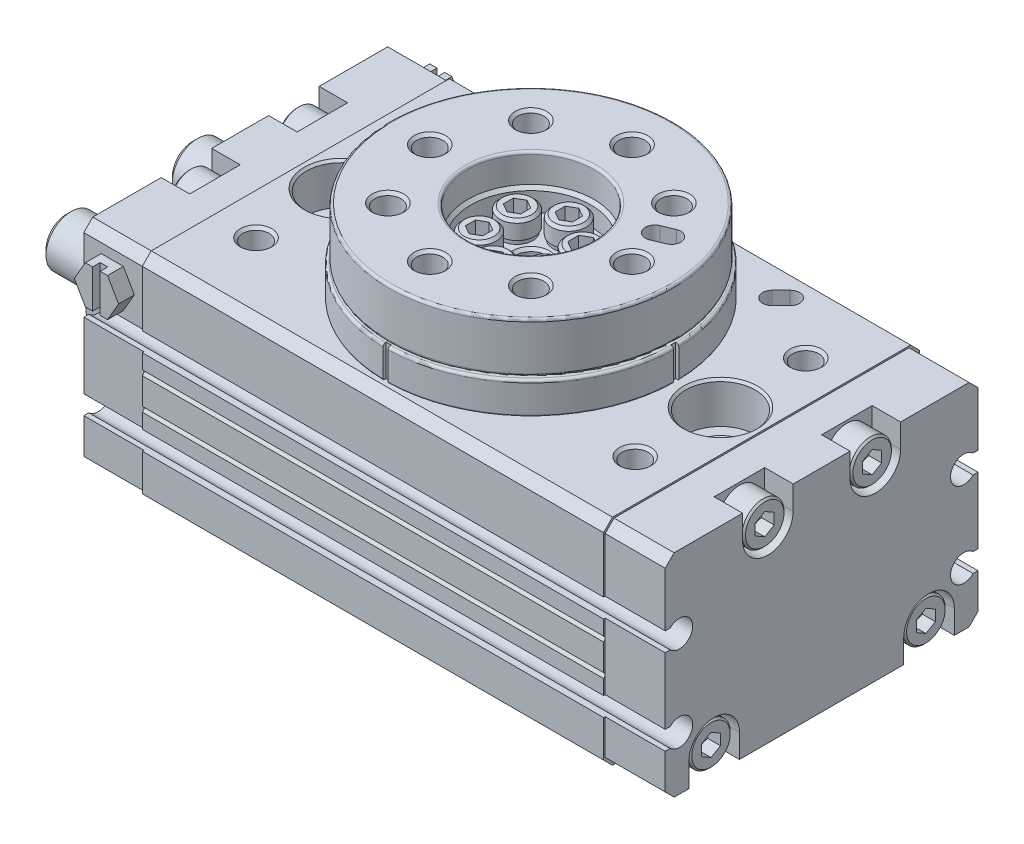
from build123d import *

# Parameters (mm, degrees)
EXTRUDE_1_DEPTH      = 36.5
EXTRUDE_1_DEPTH_BACK = 36.5
EXTRUDE_2_DEPTH      = 9.5
EXTRUDE_START        = -9.5
EXTRUDE_3_DEPTH      = 9.5
SKETCH_7_R           = 8
CUT_EXTRUDE_1_DEPTH  = 9.5
SKETCH_8_R           = 8
CUT_EXTRUDE_2_DEPTH  = 9.5
CUT_EXTRUDE_3_DEPTH  = 3.5
CUT_EXTRUDE_4_DEPTH  = 3.5
CUT_EXTRUDE_5_DEPTH  = 3.5
CUT_EXTRUDE_6_DEPTH  = 7.5
CUT_EXTRUDE_7_DEPTH  = 7.5
CUT_EXTRUDE_8_DEPTH  = 7.5
CUT_EXTRUDE_9_DEPTH  = 7.5
CUT_EXTRUDE_10_DEPTH = 7.5
CUT_EXTRUDE_11_DEPTH = 7.5
EXTRUDE_4_DEPTH      = 10
EXTRUDE_5_DEPTH      = 10
SKETCH_45_W          = 1.2
SKETCH_45_H          = 1.2
CUT_EXTRUDE_12_DEPTH = 10
SKETCH_46_W          = 1.2
SKETCH_46_H          = 1.2
CUT_EXTRUDE_13_DEPTH = 10
CUT_EXTRUDE_14_DEPTH = 4.5
CUT_EXTRUDE_15_DEPTH = 4.5
CUT_EXTRUDE_16_DEPTH = 4.5
CUT_EXTRUDE_17_DEPTH = 4.5
CUT_EXTRUDE_START    = 4.5
CUT_EXTRUDE_18_DEPTH = 4.5
CUT_EXTRUDE_19_DEPTH = 4.5
CUT_EXTRUDE_20_DEPTH = 4.5
CUT_EXTRUDE_21_DEPTH = 4.5
SKETCH_63_R          = 2.732050808
EXTRUDE_6_DEPTH      = 4.5
SKETCH_64_R          = 2.732050808
EXTRUDE_7_DEPTH      = 4.5
SKETCH_65_R          = 2.732050808
EXTRUDE_8_DEPTH      = 4.5
SKETCH_66_R          = 2.732050808
EXTRUDE_9_DEPTH      = 4.5
SKETCH_67_R          = 2.732050808
EXTRUDE_10_DEPTH     = 4.5
SKETCH_68_R          = 2.732050808
EXTRUDE_11_DEPTH     = 4.5
SKETCH_69_R          = 2.732050808
EXTRUDE_12_DEPTH     = 4.5
SKETCH_70_R          = 2.732050808
EXTRUDE_13_DEPTH     = 4.5
CUT_EXTRUDE_START_2  = -5
SKETCH_71_R          = 26
CUT_EXTRUDE_22_DEPTH = 5


with BuildPart() as part:
    # 草图1 → 凸台-拉伸1 (new, two sides: drawn at the far end of the back side and taken through both)
    with BuildSketch(Plane(origin=(0, 0, 0), x_dir=(0, 0, -1), z_dir=(1, 0, 0)).offset(-EXTRUDE_1_DEPTH_BACK)):
        with BuildLine():
            Line((-25, 23.75), (-23.969693846, 23.75))
            ThreePointArc((-23.969693846, 23.75), (-20.4, 22.25), (-23.969693846, 20.75))
            Line((-23.969693846, 20.75), (-25, 20.75))
            Line((-25, 20.75), (-25, 18.4))
            Line((-25, 18.4), (-24.6, 18))
            Line((-24.6, 18), (-25, 17.6))
            Line((-25, 17.6), (-25, 13.4))
            Line((-25, 13.4), (-24.6, 13))
            Line((-24.6, 13), (-25, 12.6))
            Line((-25, 12.6), (-25, 10.25))
            Line((-25, 10.25), (-23.969693846, 10.25))
            ThreePointArc((-23.969693846, 10.25), (-20.4, 8.75), (-23.969693846, 7.25))
            Line((-23.969693846, 7.25), (-25, 7.25))
            Line((-25, 7.25), (-25, 1.414213562))
            Line((-25, 1.414213562), (-23.585786438, 0))
            Line((-23.585786438, 0), (23.585786438, 0))
            Line((23.585786438, 0), (25, 1.414213562))
            Line((25, 1.414213562), (25, 7.25))
            Line((25, 7.25), (23.969693846, 7.25))
            ThreePointArc((23.969693846, 7.25), (20.4, 8.75), (23.969693846, 10.25))
            Line((23.969693846, 10.25), (25, 10.25))
            Line((25, 10.25), (25, 12.6))
            Line((25, 12.6), (24.6, 13))
            Line((24.6, 13), (25, 13.4))
            Line((25, 13.4), (25, 17.6))
            Line((25, 17.6), (24.6, 18))
            Line((24.6, 18), (25, 18.4))
            Line((25, 18.4), (25, 20.75))
            Line((25, 20.75), (23.969693846, 20.75))
            ThreePointArc((23.969693846, 20.75), (20.4, 22.25), (23.969693846, 23.75))
            Line((23.969693846, 23.75), (25, 23.75))
            Line((25, 23.75), (25, 32.585786438))
            Line((25, 32.585786438), (23.585786438, 34))
            Line((23.585786438, 34), (-23.585786438, 34))
            Line((-23.585786438, 34), (-25, 32.585786438))
            Line((-25, 32.585786438), (-25, 23.75))
        make_face()
    extrude(amount=EXTRUDE_1_DEPTH + EXTRUDE_1_DEPTH_BACK)

    # 草图2 → 旋转1 (revolve)
    with BuildSketch(Plane.XY):
        with BuildLine():
            Line((0, 39), (9.5, 39))
            Line((9.5, 39), (9.5, 42))
            Line((9.5, 42), (10, 42.5))
            Line((10, 42.5), (10, 46.6))
            ThreePointArc((10, 46.6), (10.117157288, 46.882842712), (10.4, 47))
            Line((10.4, 47), (22.1, 47))
            ThreePointArc((22.1, 47), (22.382842712, 46.882842712), (22.5, 46.6))
            Line((22.5, 46.6), (22.5, 39.5))
            ThreePointArc((22.5, 39.5), (22.353553391, 39.146446609), (22, 39))
            Line((22, 39), (22.6, 39))
            ThreePointArc((22.6, 39), (22.882842712, 38.882842712), (23, 38.6))
            Line((23, 38.6), (23, 34.2))
            ThreePointArc((23, 34.2), (22.941421356, 34.058578644), (22.8, 34))
            Line((22.8, 34), (0, 34))
            Line((0, 34), (0, 39))
        make_face()
    revolve(axis=Axis((0, 34, 0), (0, 1, 0)))

    # 草图3 → 凸台-拉伸2 (add)
    with BuildSketch(Plane(origin=(36.5, 0, 0), x_dir=(0, 0, -1), z_dir=(1, 0, 0))):
        with BuildLine():
            Line((-24.75, 23.75), (-23.969693846, 23.75))
            ThreePointArc((-23.969693846, 23.75), (-20.4, 22.25), (-23.969693846, 20.75))
            Line((-23.969693846, 20.75), (-24.75, 20.75))
            Line((-24.75, 20.75), (-24.75, 10.25))
            Line((-24.75, 10.25), (-23.969693846, 10.25))
            ThreePointArc((-23.969693846, 10.25), (-20.4, 8.75), (-23.969693846, 7.25))
            Line((-23.969693846, 7.25), (-24.75, 7.25))
            Line((-24.75, 7.25), (-24.75, 1.664213562))
            Line((-24.75, 1.664213562), (-23.335786438, 0.25))
            Line((-23.335786438, 0.25), (23.335786438, 0.25))
            Line((23.335786438, 0.25), (24.75, 1.664213562))
            Line((24.75, 1.664213562), (24.75, 7.25))
            Line((24.75, 7.25), (23.969693846, 7.25))
            ThreePointArc((23.969693846, 7.25), (20.4, 8.75), (23.969693846, 10.25))
            Line((23.969693846, 10.25), (24.75, 10.25))
            Line((24.75, 10.25), (24.75, 20.75))
            Line((24.75, 20.75), (23.969693846, 20.75))
            ThreePointArc((23.969693846, 20.75), (20.4, 22.25), (23.969693846, 23.75))
            Line((23.969693846, 23.75), (24.75, 23.75))
            Line((24.75, 23.75), (24.75, 32.335786438))
            Line((24.75, 32.335786438), (23.335786438, 33.75))
            Line((23.335786438, 33.75), (-23.335786438, 33.75))
            Line((-23.335786438, 33.75), (-24.75, 32.335786438))
            Line((-24.75, 32.335786438), (-24.75, 23.75))
        make_face()
    extrude(amount=EXTRUDE_2_DEPTH)

    # 草图4 → 凸台-拉伸3 (add)
    with BuildSketch(Plane(origin=(-36.5, 0, 0), x_dir=(0, 0, -1), z_dir=(1, 0, 0)).offset(EXTRUDE_START)):
        with BuildLine():
            Line((-24.75, 23.75), (-23.969693846, 23.75))
            ThreePointArc((-23.969693846, 23.75), (-20.4, 22.25), (-23.969693846, 20.75))
            Line((-23.969693846, 20.75), (-24.75, 20.75))
            Line((-24.75, 20.75), (-24.75, 10.25))
            Line((-24.75, 10.25), (-23.969693846, 10.25))
            ThreePointArc((-23.969693846, 10.25), (-20.4, 8.75), (-23.969693846, 7.25))
            Line((-23.969693846, 7.25), (-24.75, 7.25))
            Line((-24.75, 7.25), (-24.75, 1.664213562))
            Line((-24.75, 1.664213562), (-23.335786438, 0.25))
            Line((-23.335786438, 0.25), (23.335786438, 0.25))
            Line((23.335786438, 0.25), (24.75, 1.664213562))
            Line((24.75, 1.664213562), (24.75, 7.25))
            Line((24.75, 7.25), (23.969693846, 7.25))
            ThreePointArc((23.969693846, 7.25), (20.4, 8.75), (23.969693846, 10.25))
            Line((23.969693846, 10.25), (24.75, 10.25))
            Line((24.75, 10.25), (24.75, 20.75))
            Line((24.75, 20.75), (23.969693846, 20.75))
            ThreePointArc((23.969693846, 20.75), (20.4, 22.25), (23.969693846, 23.75))
            Line((23.969693846, 23.75), (24.75, 23.75))
            Line((24.75, 23.75), (24.75, 32.335786438))
            Line((24.75, 32.335786438), (23.335786438, 33.75))
            Line((23.335786438, 33.75), (-23.335786438, 33.75))
            Line((-23.335786438, 33.75), (-24.75, 32.335786438))
            Line((-24.75, 32.335786438), (-24.75, 23.75))
        make_face()
    extrude(amount=EXTRUDE_3_DEPTH)

    # 草图5 → 旋转2 (revolve)
    with BuildSketch(Plane(origin=(0, 15.5, 0), x_dir=(1, 0, 0), z_dir=(0, 1, 0))):
        with BuildLine():
            Line((-63.5, 10), (-63.5, 13.233))
            Line((-63.5, 13.233), (-62.733, 14))
            Line((-62.733, 14), (-54.5, 14))
            Line((-54.5, 14), (-54.5, 15.95))
            ThreePointArc((-54.5, 15.95), (-53.972792206, 17.222792206), (-52.7, 17.75))
            Line((-52.7, 17.75), (-47.75, 17.75))
            Line((-47.75, 17.75), (-47.5, 17.5))
            Line((-47.5, 17.5), (-47.25, 17.75))
            Line((-47.25, 17.75), (-46, 17.75))
            Line((-46, 17.75), (-46, 10))
            Line((-46, 10), (-63.5, 10))
        make_face()
    revolve(axis=Axis((-46, 15.5, -10), (-1, 0, 0)))

    # 草图6 → 旋转3 (revolve)
    with BuildSketch(Plane(origin=(0, 15.5, 0), x_dir=(1, 0, 0), z_dir=(0, 1, 0))):
        with BuildLine():
            Line((-63.5, -10), (-63.5, -6.767))
            Line((-63.5, -6.767), (-62.733, -6))
            Line((-62.733, -6), (-54.5, -6))
            Line((-54.5, -6), (-54.5, -4.05))
            ThreePointArc((-54.5, -4.05), (-53.972792206, -2.777207794), (-52.7, -2.25))
            Line((-52.7, -2.25), (-47.75, -2.25))
            Line((-47.75, -2.25), (-47.5, -2.5))
            Line((-47.5, -2.5), (-47.25, -2.25))
            Line((-47.25, -2.25), (-46, -2.25))
            Line((-46, -2.25), (-46, -10))
            Line((-46, -10), (-63.5, -10))
        make_face()
    revolve(axis=Axis((-46, 15.5, 10), (-1, 0, 0)))

    # 草图7 → 切除-拉伸1 (cut)
    with BuildSketch(Plane(origin=(-49, 0, 0), x_dir=(0, 0, -1), z_dir=(1, 0, 0))):
        with Locations((10, 15.5)):
            Circle(SKETCH_7_R)
        Polygon((4, 18.964101615), (4, 12.035898385), (10, 8.57179677), (16, 12.035898385), (16, 18.964101615), (10, 22.42820323), align=None, mode=Mode.SUBTRACT)
    extrude(amount=-CUT_EXTRUDE_1_DEPTH, mode=Mode.SUBTRACT)

    # 草图8 → 切除-拉伸2 (cut)
    with BuildSketch(Plane(origin=(-49, 0, 0), x_dir=(0, 0, -1), z_dir=(1, 0, 0))):
        with Locations((-10, 15.5)):
            Circle(SKETCH_8_R)
        Polygon((-16, 18.964101615), (-16, 12.035898385), (-10, 8.57179677), (-4, 12.035898385), (-4, 18.964101615), (-10, 22.42820323), align=None, mode=Mode.SUBTRACT)
    extrude(amount=-CUT_EXTRUDE_2_DEPTH, mode=Mode.SUBTRACT)

    # 草图9 → 切除-旋转1 (revolve, cut)
    with BuildSketch(Plane.XY):
        Polygon((30, 0), (26, 0), (26.6765, 0.6765), (26.6765, 12), (26.6, 12), (26.6, 27.146446609), (26.246446609, 27.5), (24.5, 27.5), (24.5, 33.646446609), (24.146446609, 34), (30, 34), align=None)
    revolve(axis=Axis((30, 34, 0), (0, -1, 0)), mode=Mode.SUBTRACT)

    # 草图10 → 切除-旋转2 (revolve, cut)
    with BuildSketch(Plane.XY):
        Polygon((-30, 0), (-34, 0), (-33.3235, 0.6765), (-33.3235, 12), (-33.4, 12), (-33.4, 27.146446609), (-33.753553391, 27.5), (-35.5, 27.5), (-35.5, 33.646446609), (-35.853553391, 34), (-30, 34), align=None)
    revolve(axis=Axis((-30, 34, 0), (0, -1, 0)), mode=Mode.SUBTRACT)

    # 草图11 → 切除-旋转3 (revolve, cut)
    with BuildSketch(Plane.XY.offset(13.5)):
        Polygon((-30, 26), (-32.067, 26), (-32.067, 33.567), (-32.5, 34), (-30, 34), align=None)
    revolve(axis=Axis((-30, 34, 13.5), (0, -1, 0)), mode=Mode.SUBTRACT)

    # 草图12 → 切除-旋转4 (revolve, cut)
    with BuildSketch(Plane.XY.offset(13.5)):
        Polygon((30, 26), (27.933, 26), (27.933, 33.567), (27.5, 34), (30, 34), align=None)
    revolve(axis=Axis((30, 34, 13.5), (0, -1, 0)), mode=Mode.SUBTRACT)

    # 草图13 → 切除-旋转5 (revolve, cut)
    with BuildSketch(Plane.XY.offset(-13.5)):
        Polygon((-30, 26), (-32.067, 26), (-32.067, 33.567), (-32.5, 34), (-30, 34), align=None)
    revolve(axis=Axis((-30, 34, -13.5), (0, -1, 0)), mode=Mode.SUBTRACT)

    # 草图14 → 切除-旋转6 (revolve, cut)
    with BuildSketch(Plane.XY.offset(-13.5)):
        Polygon((30, 26), (27.933, 26), (27.933, 33.567), (27.5, 34), (30, 34), align=None)
    revolve(axis=Axis((30, 34, -13.5), (0, -1, 0)), mode=Mode.SUBTRACT)

    # 草图15 → 切除-旋转7 (revolve, cut)
    with BuildSketch(Plane.XY):
        Polygon((0, 39), (2.924264069, 39), (2.5, 38.575735931), (2.5, 3), (7.5, 3), (7.5, 0.424264069), (7.924264069, 0), (0, 0), align=None)
    revolve(axis=Axis((0, 0, 0), (0, 1, 0)), mode=Mode.SUBTRACT)

    # 草图16 → 切除-拉伸3 (cut)
    with BuildSketch(Plane(origin=(0, 0, 0), x_dir=(1, 0, 0), z_dir=(0, 1, 0))):
        with BuildLine():
            Line((19, -1.5), (21, -1.5))
            ThreePointArc((21, -1.5), (22.5, 0), (21, 1.5))
            Line((21, 1.5), (19, 1.5))
            ThreePointArc((19, 1.5), (17.5, 0), (19, -1.5))
        make_face()
    extrude(amount=CUT_EXTRUDE_3_DEPTH, mode=Mode.SUBTRACT)

    # 草图17 → 切除-拉伸4 (cut)
    with BuildSketch(Plane(origin=(0, 34, 0), x_dir=(1, 0, 0), z_dir=(0, 1, 0))):
        with BuildLine():
            Line((20.152543264, 18.03122292), (21.566756826, 19.445436483))
            ThreePointArc((21.566756826, 19.445436483), (21.566756826, 21.566756826), (19.445436483, 21.566756826))
            Line((19.445436483, 21.566756826), (18.03122292, 20.152543264))
            ThreePointArc((18.03122292, 20.152543264), (18.03122292, 18.03122292), (20.152543264, 18.03122292))
        make_face()
    extrude(amount=-CUT_EXTRUDE_4_DEPTH, mode=Mode.SUBTRACT)

    # 草图18 → 切除-拉伸5 (cut)
    with BuildSketch(Plane(origin=(0, 47, 0), x_dir=(1, 0, 0), z_dir=(0, 1, 0))):
        with BuildLine():
            Line((14.432218136, 4.354432187), (16.279977201, 5.119799051))
            ThreePointArc((16.279977201, 5.119799051), (17.091771351, 7.079643499), (15.131926904, 7.891437649))
            Line((15.131926904, 7.891437649), (13.284167839, 7.126070784))
            ThreePointArc((13.284167839, 7.126070784), (12.472373689, 5.166226337), (14.432218136, 4.354432187))
        make_face()
    extrude(amount=-CUT_EXTRUDE_5_DEPTH, mode=Mode.SUBTRACT)

    # 草图19 → 切除-旋转8 (revolve, cut)
    with BuildSketch(Plane.XY):
        Polygon((16, 39), (13.933, 39), (13.933, 46.567), (13.5, 47), (16, 47), align=None)
    revolve(axis=Axis((16, 47, 0), (0, -1, 0)), mode=Mode.SUBTRACT)

    # 草图21 → 切除-旋转9 (revolve, cut)
    with BuildSketch(Plane.XY.offset(11.313708499)):
        Polygon((11.313708499, 39), (9.246708499, 39), (9.246708499, 46.567), (8.813708499, 47), (11.313708499, 47), align=None)
    revolve(axis=Axis((11.313708499, 47, 11.313708499), (0, -1, 0)), mode=Mode.SUBTRACT)

    # 草图22 → 切除-旋转10 (revolve, cut)
    with BuildSketch(Plane.XY.offset(-11.313708499)):
        Polygon((11.313708499, 39), (9.246708499, 39), (9.246708499, 46.567), (8.813708499, 47), (11.313708499, 47), align=None)
    revolve(axis=Axis((11.313708499, 47, -11.313708499), (0, -1, 0)), mode=Mode.SUBTRACT)

    # 草图23 → 切除-旋转11 (revolve, cut)
    with BuildSketch(Plane.XY.offset(-11.313708499)):
        Polygon((-11.313708499, 39), (-13.380708499, 39), (-13.380708499, 46.567), (-13.813708499, 47), (-11.313708499, 47), align=None)
    revolve(axis=Axis((-11.313708499, 47, -11.313708499), (0, -1, 0)), mode=Mode.SUBTRACT)

    # 草图24 → 切除-旋转12 (revolve, cut)
    with BuildSketch(Plane.XY.offset(11.313708499)):
        Polygon((-11.313708499, 39), (-13.380708499, 39), (-13.380708499, 46.567), (-13.813708499, 47), (-11.313708499, 47), align=None)
    revolve(axis=Axis((-11.313708499, 47, 11.313708499), (0, -1, 0)), mode=Mode.SUBTRACT)

    # 草图25 → 切除-旋转13 (revolve, cut)
    with BuildSketch(Plane.XY):
        Polygon((-16, 39), (-18.067, 39), (-18.067, 46.567), (-18.5, 47), (-16, 47), align=None)
    revolve(axis=Axis((-16, 47, 0), (0, -1, 0)), mode=Mode.SUBTRACT)

    # 草图26 → 切除-旋转14 (revolve, cut)
    with BuildSketch(Plane.XY.offset(16)):
        Polygon((0, 39), (-2.067, 39), (-2.067, 46.567), (-2.5, 47), (0, 47), align=None)
    revolve(axis=Axis((0, 47, 16), (0, -1, 0)), mode=Mode.SUBTRACT)

    # 草图27 → 切除-旋转15 (revolve, cut)
    with BuildSketch(Plane.XY.offset(-16)):
        Polygon((0, 39), (-2.067, 39), (-2.067, 46.567), (-2.5, 47), (0, 47), align=None)
    revolve(axis=Axis((0, 47, -16), (0, -1, 0)), mode=Mode.SUBTRACT)

    # 草图28 → 旋转4 (revolve)
    with BuildSketch(Plane(origin=(0, 0, 0), x_dir=(0.8660254037844386, 0, -0.4999999999999999), z_dir=(0.49999999999999994, 0, 0.8660254037844387))):
        Polygon((6, 39), (3.5, 39), (3.5, 39.558578644), (3.358578644, 39.7), (3.25, 39.7), (3.25, 42.075735931), (3.674264069, 42.5), (4.912768775, 42.5), (4.912768775, 40), (5.345781477, 39.25), (6, 39.25), align=None)
    revolve(axis=Axis((5.196152423, 42.5, -3), (0, -1, 0)))

    # 草图30 → 旋转5 (revolve)
    with BuildSketch(Plane(origin=(-2.598076211, 0, -4.5), x_dir=(0.8660254037844386, 0, -0.4999999999999999), z_dir=(0.49999999999999994, 0, 0.8660254037844387))):
        Polygon((-3, 39), (-5.5, 39), (-5.5, 39.558578644), (-5.641421356, 39.7), (-5.75, 39.7), (-5.75, 42.075735931), (-5.325735931, 42.5), (-4.087231225, 42.5), (-4.087231225, 40), (-3.654218523, 39.25), (-3, 39.25), align=None)
    revolve(axis=Axis((-5.196152423, 42.5, -3), (0, -1, 0)))

    # 草图31 → 旋转6 (revolve)
    with BuildSketch(Plane(origin=(0, 0, 0), x_dir=(0.8660254037844386, 0, -0.4999999999999999), z_dir=(0.49999999999999994, 0, 0.8660254037844387))):
        Polygon((-6, 39), (-8.5, 39), (-8.5, 39.558578644), (-8.641421356, 39.7), (-8.75, 39.7), (-8.75, 42.075735931), (-8.325735931, 42.5), (-7.087231225, 42.5), (-7.087231225, 40), (-6.654218523, 39.25), (-6, 39.25), align=None)
    revolve(axis=Axis((-5.196152423, 42.5, 3), (0, -1, 0)))

    # 草图32 → 旋转7 (revolve)
    with BuildSketch(Plane(origin=(2.598076211, 0, 4.5), x_dir=(0.8660254037844386, 0, -0.4999999999999999), z_dir=(0.49999999999999994, 0, 0.8660254037844387))):
        Polygon((-3, 39), (-5.5, 39), (-5.5, 39.558578644), (-5.641421356, 39.7), (-5.75, 39.7), (-5.75, 42.075735931), (-5.325735931, 42.5), (-4.087231225, 42.5), (-4.087231225, 40), (-3.654218523, 39.25), (-3, 39.25), align=None)
    revolve(axis=Axis((0, 42.5, 6), (0, -1, 0)))

    # 草图33 → 旋转8 (revolve)
    with BuildSketch(Plane(origin=(-2.598076211, 0, -4.5), x_dir=(0.8660254037844386, 0, -0.4999999999999999), z_dir=(0.49999999999999994, 0, 0.8660254037844387))):
        Polygon((3, 39), (0.5, 39), (0.5, 39.558578644), (0.358578644, 39.7), (0.25, 39.7), (0.25, 42.075735931), (0.674264069, 42.5), (1.912768775, 42.5), (1.912768775, 40), (2.345781477, 39.25), (3, 39.25), align=None)
    revolve(axis=Axis((0, 42.5, -6), (0, -1, 0)))

    # 草图34 → 旋转9 (revolve)
    with BuildSketch(Plane(origin=(2.598076211, 0, 4.5), x_dir=(0.8660254037844386, 0, -0.4999999999999999), z_dir=(0.49999999999999994, 0, 0.8660254037844387))):
        Polygon((3, 39), (0.5, 39), (0.5, 39.558578644), (0.358578644, 39.7), (0.25, 39.7), (0.25, 42.075735931), (0.674264069, 42.5), (1.912768775, 42.5), (1.912768775, 40), (2.345781477, 39.25), (3, 39.25), align=None)
    revolve(axis=Axis((5.196152423, 42.5, 3), (0, -1, 0)))

    # 草图35 → 切除-拉伸6 (cut)
    with BuildSketch(Plane(origin=(0, 47, 0), x_dir=(1, 0, 0), z_dir=(0, 1, 0))):
        Polygon((3.696152423, 3.866025404), (3.696152423, 2.133974596), (5.196152423, 1.267949192), (6.696152423, 2.133974596), (6.696152423, 3.866025404), (5.196152423, 4.732050808), align=None)
    extrude(amount=-CUT_EXTRUDE_6_DEPTH, mode=Mode.SUBTRACT)

    # 草图36 → 切除-拉伸7 (cut)
    with BuildSketch(Plane(origin=(0, 47, 0), x_dir=(1, 0, 0), z_dir=(0, 1, 0))):
        Polygon((-6.571152423, 3.79385662), (-6.571152423, 2.20614338), (-5.196152423, 1.41228676), (-3.821152423, 2.20614338), (-3.821152423, 3.79385662), (-5.196152423, 4.58771324), align=None)
    extrude(amount=-CUT_EXTRUDE_7_DEPTH, mode=Mode.SUBTRACT)

    # 草图37 → 切除-拉伸8 (cut)
    with BuildSketch(Plane(origin=(0, 47, 0), x_dir=(1, 0, 0), z_dir=(0, 1, 0))):
        Polygon((3.821152423, -2.20614338), (3.821152423, -3.79385662), (5.196152423, -4.58771324), (6.571152423, -3.79385662), (6.571152423, -2.20614338), (5.196152423, -1.41228676), align=None)
    extrude(amount=-CUT_EXTRUDE_8_DEPTH, mode=Mode.SUBTRACT)

    # 草图38 → 切除-拉伸9 (cut)
    with BuildSketch(Plane(origin=(0, 47, 0), x_dir=(1, 0, 0), z_dir=(0, 1, 0))):
        Polygon((-6.571152423, -2.20614338), (-6.571152423, -3.79385662), (-5.196152423, -4.58771324), (-3.821152423, -3.79385662), (-3.821152423, -2.20614338), (-5.196152423, -1.41228676), align=None)
    extrude(amount=-CUT_EXTRUDE_9_DEPTH, mode=Mode.SUBTRACT)

    # 草图39 → 切除-拉伸10 (cut)
    with BuildSketch(Plane(origin=(0, 47, 0), x_dir=(1, 0, 0), z_dir=(0, 1, 0))):
        Polygon((-1.375, 6.79385662), (-1.375, 5.20614338), (0, 4.41228676), (1.375, 5.20614338), (1.375, 6.79385662), (0, 7.58771324), align=None)
    extrude(amount=-CUT_EXTRUDE_10_DEPTH, mode=Mode.SUBTRACT)

    # 草图40 → 切除-拉伸11 (cut)
    with BuildSketch(Plane(origin=(0, 47, 0), x_dir=(1, 0, 0), z_dir=(0, 1, 0))):
        Polygon((-1.375, -5.20614338), (-1.375, -6.79385662), (0, -7.58771324), (1.375, -6.79385662), (1.375, -5.20614338), (0, -4.41228676), align=None)
    extrude(amount=-CUT_EXTRUDE_11_DEPTH, mode=Mode.SUBTRACT)

    # 草图41 → 凸台-拉伸4 (add)
    with BuildSketch(Plane.XY.offset(17.25)):
        Polygon((-45, 27.8), (-43.25, 24.768911087), (-39.75, 24.768911087), (-38, 27.8), (-39.75, 30.831088913), (-43.25, 30.831088913), align=None)
    extrude(amount=EXTRUDE_4_DEPTH)

    # 草图42 → 切除-旋转16 (revolve, cut)
    with BuildSketch(Plane.XY.offset(17.25)):
        Polygon((-36.5, 27.8), (-36.5, 25.733), (-45.567, 25.733), (-46, 25.3), (-46, 27.8), align=None)
    revolve(axis=Axis((-46, 27.8, 17.25), (1, 0, 0)), mode=Mode.SUBTRACT)

    # 草图43 → 凸台-拉伸5 (add)
    with BuildSketch(Plane.XY.offset(-17.25)):
        Polygon((-45, 27.8), (-43.25, 24.768911087), (-39.75, 24.768911087), (-38, 27.8), (-39.75, 30.831088913), (-43.25, 30.831088913), align=None)
    extrude(amount=-EXTRUDE_5_DEPTH)

    # 草图44 → 切除-旋转17 (revolve, cut)
    with BuildSketch(Plane.XY.offset(-17.25)):
        Polygon((-36.5, 27.8), (-36.5, 25.733), (-45.567, 25.733), (-46, 25.3), (-46, 27.8), align=None)
    revolve(axis=Axis((-46, 27.8, -17.25), (1, 0, 0)), mode=Mode.SUBTRACT)

    # 草图45 → 切除-拉伸12 (cut)
    with BuildSketch(Plane(origin=(0, 34, 0), x_dir=(1, 0, 0), z_dir=(0, 1, 0))):
        with Locations((-41.5, -26.65)):
            Rectangle(SKETCH_45_W, SKETCH_45_H)
    extrude(amount=-CUT_EXTRUDE_12_DEPTH, mode=Mode.SUBTRACT)

    # 草图46 → 切除-拉伸13 (cut)
    with BuildSketch(Plane(origin=(0, 34, 0), x_dir=(1, 0, 0), z_dir=(0, 1, 0))):
        with Locations((-41.5, 26.65)):
            Rectangle(SKETCH_46_W, SKETCH_46_H)
    extrude(amount=-CUT_EXTRUDE_13_DEPTH, mode=Mode.SUBTRACT)

    # 草图47 → 切除-拉伸14 (cut)
    with BuildSketch(Plane(origin=(46, 0, 0), x_dir=(0, 0, -1), z_dir=(1, 0, 0))):
        with BuildLine():
            Line((4.5, 34), (4.5, 30))
            ThreePointArc((4.5, 30), (8.5, 26), (12.5, 30))
            Line((12.5, 30), (12.5, 34))
            Line((12.5, 34), (4.5, 34))
        make_face()
    extrude(amount=-CUT_EXTRUDE_14_DEPTH, mode=Mode.SUBTRACT)

    # 草图48 → 切除-拉伸15 (cut)
    with BuildSketch(Plane(origin=(46, 0, 0), x_dir=(0, 0, -1), z_dir=(1, 0, 0))):
        with BuildLine():
            Line((-12.5, 34), (-12.5, 30))
            ThreePointArc((-12.5, 30), (-8.5, 26), (-4.5, 30))
            Line((-4.5, 30), (-4.5, 34))
            Line((-4.5, 34), (-12.5, 34))
        make_face()
    extrude(amount=-CUT_EXTRUDE_15_DEPTH, mode=Mode.SUBTRACT)

    # 草图49 → 切除-拉伸16 (cut)
    with BuildSketch(Plane(origin=(46, 0, 0), x_dir=(0, 0, -1), z_dir=(1, 0, 0))):
        with BuildLine():
            Line((13, 0), (21, 0))
            Line((21, 0), (21, 4))
            ThreePointArc((21, 4), (17, 8), (13, 4))
            Line((13, 4), (13, 0))
        make_face()
    extrude(amount=-CUT_EXTRUDE_16_DEPTH, mode=Mode.SUBTRACT)

    # 草图50 → 切除-拉伸17 (cut)
    with BuildSketch(Plane(origin=(46, 0, 0), x_dir=(0, 0, -1), z_dir=(1, 0, 0))):
        with BuildLine():
            Line((-21, 0), (-13, 0))
            Line((-13, 0), (-13, 4))
            ThreePointArc((-13, 4), (-17, 8), (-21, 4))
            Line((-21, 4), (-21, 0))
        make_face()
    extrude(amount=-CUT_EXTRUDE_17_DEPTH, mode=Mode.SUBTRACT)

    # 草图51 → 切除-拉伸18 (cut)
    with BuildSketch(Plane(origin=(-46, 0, 0), x_dir=(0, 0, -1), z_dir=(1, 0, 0)).offset(CUT_EXTRUDE_START)):
        with BuildLine():
            Line((13, 0), (21, 0))
            Line((21, 0), (21, 4))
            ThreePointArc((21, 4), (17, 8), (13, 4))
            Line((13, 4), (13, 0))
        make_face()
    extrude(amount=-CUT_EXTRUDE_18_DEPTH, mode=Mode.SUBTRACT)

    # 草图52 → 切除-拉伸19 (cut)
    with BuildSketch(Plane(origin=(-46, 0, 0), x_dir=(0, 0, -1), z_dir=(1, 0, 0)).offset(CUT_EXTRUDE_START)):
        with BuildLine():
            Line((-21, 0), (-13, 0))
            Line((-13, 0), (-13, 4))
            ThreePointArc((-13, 4), (-17, 8), (-21, 4))
            Line((-21, 4), (-21, 0))
        make_face()
    extrude(amount=-CUT_EXTRUDE_19_DEPTH, mode=Mode.SUBTRACT)

    # 草图53 → 切除-拉伸20 (cut)
    with BuildSketch(Plane(origin=(-46, 0, 0), x_dir=(0, 0, -1), z_dir=(1, 0, 0)).offset(CUT_EXTRUDE_START)):
        with BuildLine():
            Line((-12.5, 34), (-12.5, 30))
            ThreePointArc((-12.5, 30), (-8.5, 26), (-4.5, 30))
            Line((-4.5, 30), (-4.5, 34))
            Line((-4.5, 34), (-12.5, 34))
        make_face()
    extrude(amount=-CUT_EXTRUDE_20_DEPTH, mode=Mode.SUBTRACT)

    # 草图54 → 切除-拉伸21 (cut)
    with BuildSketch(Plane(origin=(-46, 0, 0), x_dir=(0, 0, -1), z_dir=(1, 0, 0)).offset(CUT_EXTRUDE_START)):
        with BuildLine():
            Line((4.5, 34), (4.5, 30))
            ThreePointArc((4.5, 30), (8.5, 26), (12.5, 30))
            Line((12.5, 30), (12.5, 34))
            Line((12.5, 34), (4.5, 34))
        make_face()
    extrude(amount=-CUT_EXTRUDE_21_DEPTH, mode=Mode.SUBTRACT)

    # 草图55 → 旋转10 (revolve)
    with BuildSketch(Plane(origin=(0, 4, 0), x_dir=(1, 0, 0), z_dir=(0, 1, 0))):
        Polygon((41.5, -17), (41.5, -13.67), (45.217157288, -13.67), (45.5, -13.952842712), (45.5, -15.25), (43.5, -15.25), (42.889637029, -16.307179677), (42.889637029, -17), align=None)
    revolve(axis=Axis((45.5, 4, 17), (-1, 0, 0)))

    # 草图56 → 旋转11 (revolve)
    with BuildSketch(Plane(origin=(0, 4, 0), x_dir=(1, 0, 0), z_dir=(0, 1, 0))):
        Polygon((41.5, 17), (41.5, 20.33), (45.217157288, 20.33), (45.5, 20.047157288), (45.5, 18.75), (43.5, 18.75), (42.889637029, 17.692820323), (42.889637029, 17), align=None)
    revolve(axis=Axis((42.889637029, 4, -17), (-1, 0, 0)))

    # 草图57 → 旋转12 (revolve)
    with BuildSketch(Plane(origin=(0, 4, 0), x_dir=(1, 0, 0), z_dir=(0, 1, 0))):
        Polygon((-42.889637029, -17), (-42.889637029, -16.307179677), (-43.5, -15.25), (-45.217157288, -15.25), (-45.5, -14.967157288), (-45.5, -13.952842712), (-45.217157288, -13.67), (-41.5, -13.67), (-41.5, -17), align=None)
    revolve(axis=Axis((-41.5, 4, 17), (-1, 0, 0)))

    # 草图58 → 旋转13 (revolve)
    with BuildSketch(Plane(origin=(0, 4, 0), x_dir=(1, 0, 0), z_dir=(0, 1, 0))):
        Polygon((-42.889637029, 17), (-42.889637029, 17.692820323), (-43.5, 18.75), (-45.217157288, 18.75), (-45.5, 19.032842712), (-45.5, 20.047157288), (-45.217157288, 20.33), (-41.5, 20.33), (-41.5, 17), align=None)
    revolve(axis=Axis((-41.5, 4, -17), (-1, 0, 0)))

    # 草图59 → 旋转14 (revolve)
    with BuildSketch(Plane(origin=(0, 30, 0), x_dir=(1, 0, 0), z_dir=(0, 1, 0))):
        Polygon((41.5, -8.5), (41.5, -5.17), (45.217157288, -5.17), (45.5, -5.452842712), (45.5, -6.75), (43.5, -6.75), (42.889637029, -7.807179677), (42.889637029, -8.5), align=None)
    revolve(axis=Axis((45.5, 30, 8.5), (-1, 0, 0)))

    # 草图60 → 旋转15 (revolve)
    with BuildSketch(Plane(origin=(0, 30, 0), x_dir=(1, 0, 0), z_dir=(0, 1, 0))):
        Polygon((41.5, 8.5), (41.5, 11.83), (45.217157288, 11.83), (45.5, 11.547157288), (45.5, 10.25), (43.5, 10.25), (42.889637029, 9.192820323), (42.889637029, 8.5), align=None)
    revolve(axis=Axis((45.5, 30, -8.5), (-1, 0, 0)))

    # 草图61 → 旋转16 (revolve)
    with BuildSketch(Plane(origin=(0, 30, 0), x_dir=(1, 0, 0), z_dir=(0, 1, 0))):
        Polygon((-42.889637029, -8.5), (-42.889637029, -7.807179677), (-43.5, -6.75), (-45.217157288, -6.75), (-45.5, -6.467157288), (-45.5, -5.452842712), (-45.217157288, -5.17), (-41.5, -5.17), (-41.5, -8.5), align=None)
    revolve(axis=Axis((-41.5, 30, 8.5), (-1, 0, 0)))

    # 草图62 → 旋转17 (revolve)
    with BuildSketch(Plane(origin=(0, 30, 0), x_dir=(1, 0, 0), z_dir=(0, 1, 0))):
        Polygon((-42.889637029, 8.5), (-42.889637029, 9.192820323), (-43.5, 10.25), (-45.217157288, 10.25), (-45.5, 10.532842712), (-45.5, 11.547157288), (-45.217157288, 11.83), (-41.5, 11.83), (-41.5, 8.5), align=None)
    revolve(axis=Axis((-41.5, 30, -8.5), (-1, 0, 0)))

    # 草图63 → 凸台-拉伸6 (add)
    with BuildSketch(Plane(origin=(45.5, 0, 0), x_dir=(0, 0, -1), z_dir=(1, 0, 0))):
        with Locations((17, 4)):
            Circle(SKETCH_63_R)
        Polygon((15.5, 4.866025404), (15.5, 3.133974596), (17, 2.267949192), (18.5, 3.133974596), (18.5, 4.866025404), (17, 5.732050808), align=None, mode=Mode.SUBTRACT)
    extrude(amount=-EXTRUDE_6_DEPTH)

    # 草图64 → 凸台-拉伸7 (add)
    with BuildSketch(Plane(origin=(45.5, 0, 0), x_dir=(0, 0, -1), z_dir=(1, 0, 0))):
        with Locations((-17, 4)):
            Circle(SKETCH_64_R)
        Polygon((-18.5, 4.866025404), (-18.5, 3.133974596), (-17, 2.267949192), (-15.5, 3.133974596), (-15.5, 4.866025404), (-17, 5.732050808), align=None, mode=Mode.SUBTRACT)
    extrude(amount=-EXTRUDE_7_DEPTH)

    # 草图65 → 凸台-拉伸8 (add)
    with BuildSketch(Plane(origin=(45.5, 0, 0), x_dir=(0, 0, -1), z_dir=(1, 0, 0))):
        with Locations((8.5, 30)):
            Circle(SKETCH_65_R)
        Polygon((7, 30.866025404), (7, 29.133974596), (8.5, 28.267949192), (10, 29.133974596), (10, 30.866025404), (8.5, 31.732050808), align=None, mode=Mode.SUBTRACT)
    extrude(amount=-EXTRUDE_8_DEPTH)

    # 草图66 → 凸台-拉伸9 (add)
    with BuildSketch(Plane(origin=(45.5, 0, 0), x_dir=(0, 0, -1), z_dir=(1, 0, 0))):
        with Locations((-8.5, 30)):
            Circle(SKETCH_66_R)
        Polygon((-10, 30.866025404), (-10, 29.133974596), (-8.5, 28.267949192), (-7, 29.133974596), (-7, 30.866025404), (-8.5, 31.732050808), align=None, mode=Mode.SUBTRACT)
    extrude(amount=-EXTRUDE_9_DEPTH)

    # 草图67 → 凸台-拉伸10 (add)
    with BuildSketch(Plane(origin=(-45.5, 0, 0), x_dir=(0, 0, -1), z_dir=(1, 0, 0))):
        with Locations((17, 4)):
            Circle(SKETCH_67_R)
        Polygon((15.5, 4.866025404), (15.5, 3.133974596), (17, 2.267949192), (18.5, 3.133974596), (18.5, 4.866025404), (17, 5.732050808), align=None, mode=Mode.SUBTRACT)
    extrude(amount=EXTRUDE_10_DEPTH)

    # 草图68 → 凸台-拉伸11 (add)
    with BuildSketch(Plane(origin=(-45.5, 0, 0), x_dir=(0, 0, -1), z_dir=(1, 0, 0))):
        with Locations((-17, 4)):
            Circle(SKETCH_68_R)
        Polygon((-18.5, 4.866025404), (-18.5, 3.133974596), (-17, 2.267949192), (-15.5, 3.133974596), (-15.5, 4.866025404), (-17, 5.732050808), align=None, mode=Mode.SUBTRACT)
    extrude(amount=EXTRUDE_11_DEPTH)

    # 草图69 → 凸台-拉伸12 (add)
    with BuildSketch(Plane(origin=(-45.5, 0, 0), x_dir=(0, 0, -1), z_dir=(1, 0, 0))):
        with Locations((8.5, 30)):
            Circle(SKETCH_69_R)
        Polygon((7, 30.866025404), (7, 29.133974596), (8.5, 28.267949192), (10, 29.133974596), (10, 30.866025404), (8.5, 31.732050808), align=None, mode=Mode.SUBTRACT)
    extrude(amount=EXTRUDE_12_DEPTH)

    # 草图70 → 凸台-拉伸13 (add)
    with BuildSketch(Plane(origin=(-45.5, 0, 0), x_dir=(0, 0, -1), z_dir=(1, 0, 0))):
        with Locations((-8.5, 30)):
            Circle(SKETCH_70_R)
        Polygon((-10, 30.866025404), (-10, 29.133974596), (-8.5, 28.267949192), (-7, 29.133974596), (-7, 30.866025404), (-8.5, 31.732050808), align=None, mode=Mode.SUBTRACT)
    extrude(amount=EXTRUDE_13_DEPTH)

    # 草图71 → 切除-拉伸22 (cut)
    with BuildSketch(Plane(origin=(0, 39, 0), x_dir=(1, 0, 0), z_dir=(0, 1, 0)).offset(CUT_EXTRUDE_START_2)):
        Circle(SKETCH_71_R)
        with BuildLine():
            Line((-24.996799795, 0.4), (-22.496444163, 0.4))
            ThreePointArc((-22.496444163, 0.4), (-22.5, 0), (-22.496444163, -0.4))
            Line((-22.496444163, -0.4), (-24.996799795, -0.4))
            ThreePointArc((-24.996799795, -0.4), (-17.67766953, -17.67766953), (-0.4, -24.996799795))
            Line((-0.4, -24.996799795), (-0.4, -22.496444163))
            ThreePointArc((-0.4, -22.496444163), (0, -22.5), (0.4, -22.496444163))
            Line((0.4, -22.496444163), (0.4, -24.996799795))
            ThreePointArc((0.4, -24.996799795), (17.67766953, -17.67766953), (24.996799795, -0.4))
            Line((24.996799795, -0.4), (22.496444163, -0.4))
            ThreePointArc((22.496444163, -0.4), (22.5, 0), (22.496444163, 0.4))
            Line((22.496444163, 0.4), (24.996799795, 0.4))
            ThreePointArc((24.996799795, 0.4), (17.67766953, 17.67766953), (0.4, 24.996799795))
            Line((0.4, 24.996799795), (0.4, 22.496444163))
            ThreePointArc((0.4, 22.496444163), (0, 22.5), (-0.4, 22.496444163))
            Line((-0.4, 22.496444163), (-0.4, 24.996799795))
            ThreePointArc((-0.4, 24.996799795), (-17.67766953, 17.67766953), (-24.996799795, 0.4))
        make_face(mode=Mode.SUBTRACT)
    extrude(amount=CUT_EXTRUDE_22_DEPTH, mode=Mode.SUBTRACT)


solid = part.part
